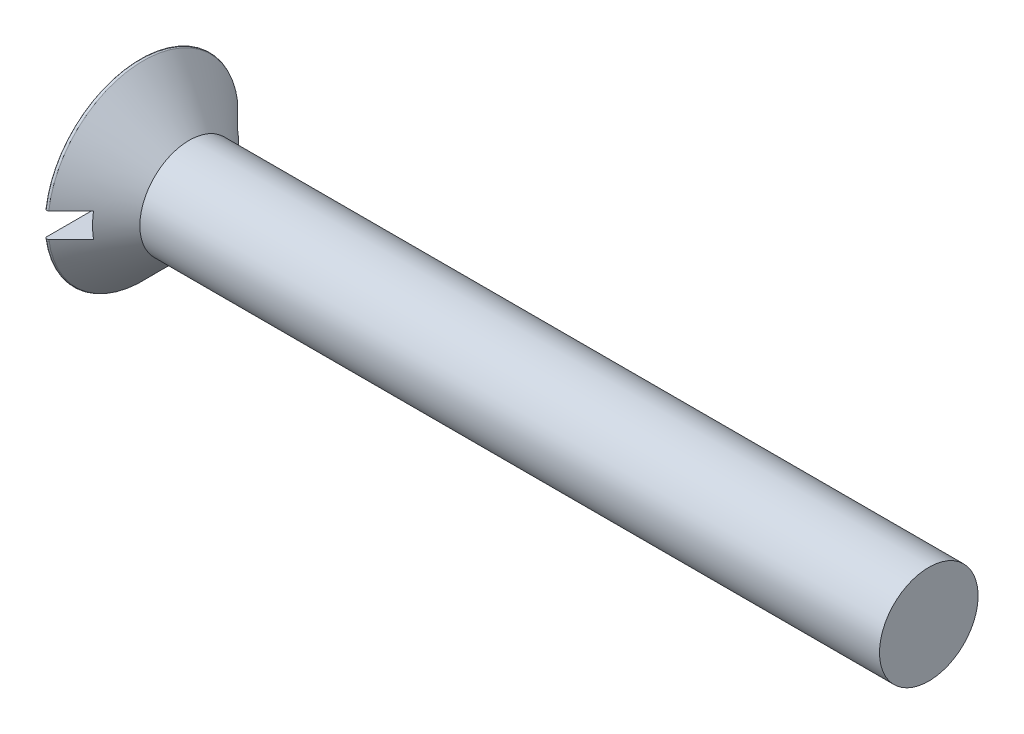
from build123d import *

# Parameters (mm, degrees)
HEADFILLET_R     = 0.2
NOTCH_DEPTH      = 82.171708713
NOTCH_DEPTH_BACK = 82.171708713
SKETCH2_W        = 2.6
SKETCH2_H        = 2.5


with BuildPart() as part:
    # Sketch1 → Base (revolve)
    with BuildSketch(Plane.XY):
        Polygon((0, 0), (0, 10), (5, 5), (80, 5), (80, 0), align=None)
    revolve(axis=Axis((-5.569640847, 0, 0), (1, 0, 0)))

    # HeadFillet
    headfillet_edges = [part.edges().sort_by_distance(p)[0] for p in [
        (0, -10, 0),
    ]]
    fillet(headfillet_edges, radius=HEADFILLET_R)

    # Sketch2 → Notch (cut, two sides: drawn at the far end of the back side and taken through both)
    with BuildSketch(Plane.XY.offset(-NOTCH_DEPTH_BACK)):
        with Locations((1.3, 0)):
            Rectangle(SKETCH2_W, SKETCH2_H)
    extrude(amount=NOTCH_DEPTH + NOTCH_DEPTH_BACK, mode=Mode.SUBTRACT)


solid = part.part
